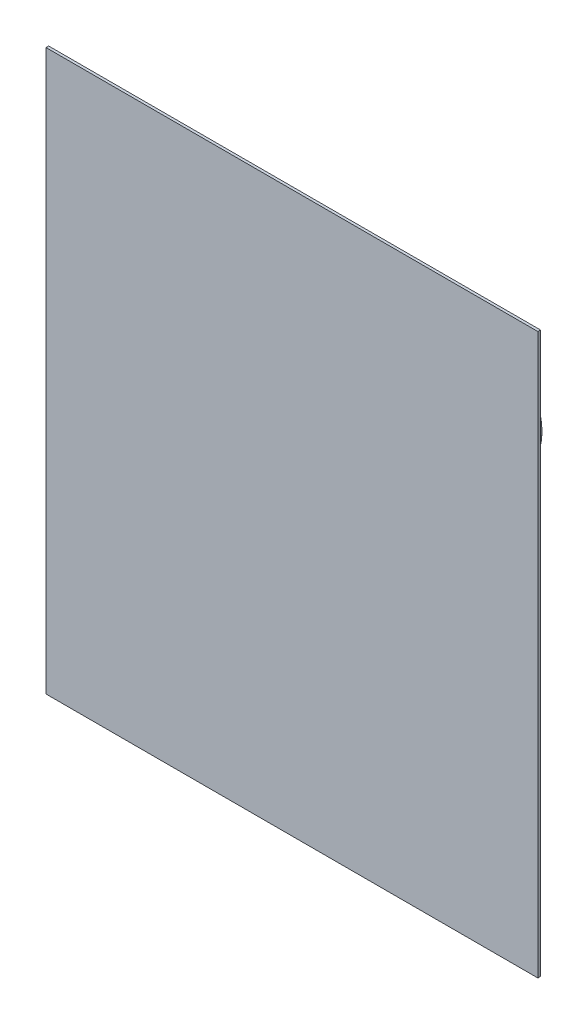
from build123d import *

# Parameters (mm, degrees)
BOSS_EXTRUDE1_START       = -19.05
BOSS_EXTRUDE1_OUTLINE_R   = 5.588
BOSS_EXTRUDE1_OUTLINE_R_2 = 2.413
BOSS_EXTRUDE1_DEPTH       = 19.05
SKETCH16_W                = 47
SKETCH16_H                = 53.5
BOSS_EXTRUDE2_DEPTH       = 0.254
FILLET1_R                 = 12.7
FILLET3_R                 = 1.27


# Read off the part's stored shape, not the designer's step: Boss-Extrude1
with BuildPart() as part:
    # Boss-Extrude1 outline → Boss-Extrude1 (new body)
    with BuildSketch(Plane.XY.offset(BOSS_EXTRUDE1_START)):
        Circle(BOSS_EXTRUDE1_OUTLINE_R)
        Circle(BOSS_EXTRUDE1_OUTLINE_R_2, mode=Mode.SUBTRACT)
    extrude(amount=BOSS_EXTRUDE1_DEPTH)

    # Sketch16 → Boss-Extrude2 (add)
    with BuildSketch(Plane.XY):
        Rectangle(SKETCH16_W, SKETCH16_H)
    extrude(amount=-BOSS_EXTRUDE2_DEPTH)

    # Fillet1
    fillet1_edges = [part.edges().sort_by_distance(p)[0] for p in [
        (-5.588, 0, -0.254),
    ]]
    fillet(fillet1_edges, radius=FILLET1_R)

    # Fillet3
    fillet3_edges = [part.edges().sort_by_distance(p)[0] for p in [
        (-5.588, 0, -19.05),
    ]]
    fillet(fillet3_edges, radius=FILLET3_R)


solid = part.part
